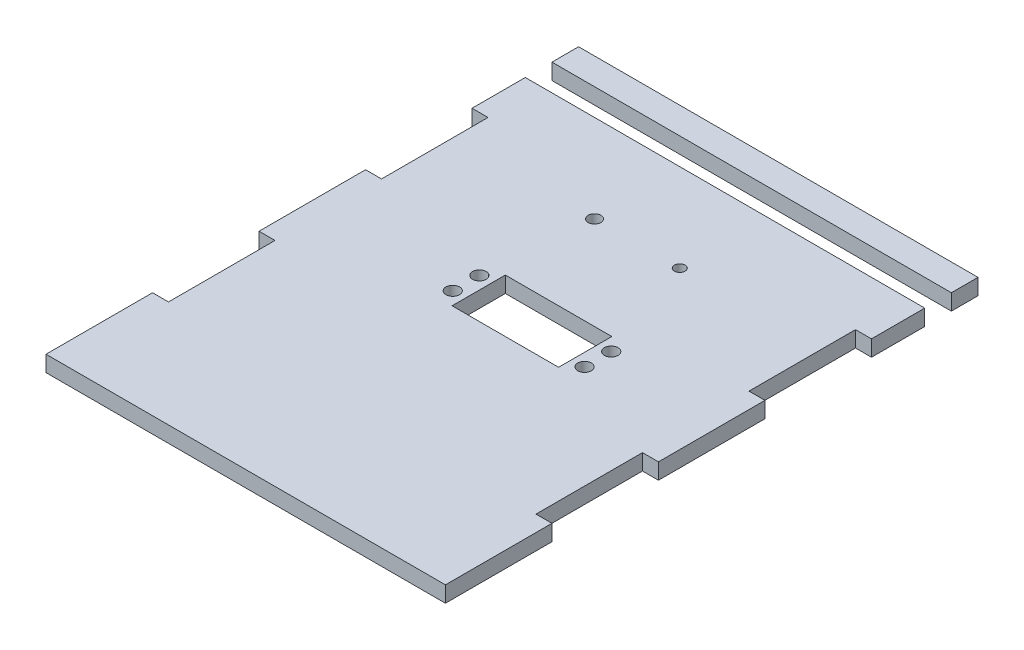
from build123d import *

# Parameters (mm, degrees)
SKETCH1_W           = 150
SKETCH1_H           = 200
BOSS_EXTRUDE1_DEPTH = 6
SKETCH2_W           = 6
SKETCH2_H           = 40
CUT_EXTRUDE1_DEPTH  = 6
SKETCH6_R           = 1.23
CUT_EXTRUDE6_DEPTH  = 126.143917151
SKETCH7_R           = 2
CUT_EXTRUDE7_DEPTH  = 126.143917151
SKETCH8_R           = 2.38
CUT_EXTRUDE8_DEPTH  = 126.143917151
SKETCH9_R           = 2.55
CUT_EXTRUDE9_DEPTH  = 126.143917151
SKETCH10_W          = 150
SKETCH10_H          = 10
CUT_EXTRUDE10_DEPTH = 6
SKETCH11_W          = 40
SKETCH11_H          = 20
CUT_EXTRUDE11_DEPTH = 6


with BuildPart() as part:
    # Sketch1 → Boss-Extrude1 (new body)
    with BuildSketch(Plane(origin=(0, 0, 0), x_dir=(1, 0, 0), z_dir=(0, 1, 0))):
        Rectangle(SKETCH1_W, SKETCH1_H)
    extrude(amount=BOSS_EXTRUDE1_DEPTH)

    # Sketch2 → Cut-Extrude1 (cut)
    with BuildSketch(Plane(origin=(0, 6, 0), x_dir=(1, 0, 0), z_dir=(0, 1, 0))):
        with Locations((-72, 40)):
            Rectangle(SKETCH2_W, SKETCH2_H)
        with Locations((72, 40)):
            Rectangle(SKETCH2_W, SKETCH2_H)
        with Locations((72, -40)):
            Rectangle(SKETCH2_W, SKETCH2_H)
        with Locations((-72, -40)):
            Rectangle(SKETCH2_W, SKETCH2_H)
    extrude(amount=-CUT_EXTRUDE1_DEPTH, mode=Mode.SUBTRACT)

    # Sketch6 → Cut-Extrude6 (cut, through all)
    with BuildSketch(Plane(origin=(0, 6, 0), x_dir=(1, 0, 0), z_dir=(0, 1, 0))):
        with Locations((16, 2)):
            Circle(SKETCH6_R)
    extrude(amount=-CUT_EXTRUDE6_DEPTH, mode=Mode.SUBTRACT)

    # Sketch7 → Cut-Extrude7 (cut, through all)
    with BuildSketch(Plane(origin=(0, 6, 0), x_dir=(1, 0, 0), z_dir=(0, 1, 0))):
        with Locations((16, 47)):
            Circle(SKETCH7_R)
    extrude(amount=-CUT_EXTRUDE7_DEPTH, mode=Mode.SUBTRACT)

    # Sketch8 → Cut-Extrude8 (cut, through all)
    with BuildSketch(Plane(origin=(0, 6, 0), x_dir=(1, 0, 0), z_dir=(0, 1, 0))):
        with Locations((-16, 47)):
            Circle(SKETCH8_R)
    extrude(amount=-CUT_EXTRUDE8_DEPTH, mode=Mode.SUBTRACT)

    # Sketch9 → Cut-Extrude9 (cut, through all)
    with BuildSketch(Plane(origin=(0, 6, 0), x_dir=(1, 0, 0), z_dir=(0, 1, 0))):
        with Locations((30.25, 7)):
            Circle(SKETCH9_R)
        with Locations((30.25, -3)):
            Circle(SKETCH9_R)
        with Locations((-19.25, 7)):
            Circle(SKETCH9_R)
        with Locations((-19.25, -3)):
            Circle(SKETCH9_R)
    extrude(amount=-CUT_EXTRUDE9_DEPTH, mode=Mode.SUBTRACT)

    # Sketch10 → Cut-Extrude10 (cut)
    with BuildSketch(Plane(origin=(0, 6, 0), x_dir=(1, 0, 0), z_dir=(0, 1, 0))):
        with Locations((0, 85)):
            Rectangle(SKETCH10_W, SKETCH10_H)
    extrude(amount=-CUT_EXTRUDE10_DEPTH, mode=Mode.SUBTRACT)


with BuildPart() as cut_extrude10_piece_1:
    # of the separate pieces the step leaves, piece 1, a body of its own (cut_extrude10_pieces)
    add(part.part.solids().sort_by_distance((-75, 0, -60))[0])

    # Sketch11 → Cut-Extrude11 (cut)
    with BuildSketch(Plane(origin=(0, 6, 0), x_dir=(1, 0, 0), z_dir=(0, 1, 0))):
        with Locations((5.5, 2)):
            Rectangle(SKETCH11_W, SKETCH11_H)
    extrude(amount=-CUT_EXTRUDE11_DEPTH, mode=Mode.SUBTRACT)


with BuildPart() as cut_extrude10_piece_2:
    # of the separate pieces the step leaves, piece 2, a body of its own (cut_extrude10_pieces)
    add(part.part.solids().sort_by_distance((-75, 0, -100))[0])


solid = Compound([cut_extrude10_piece_1.part, cut_extrude10_piece_2.part])
